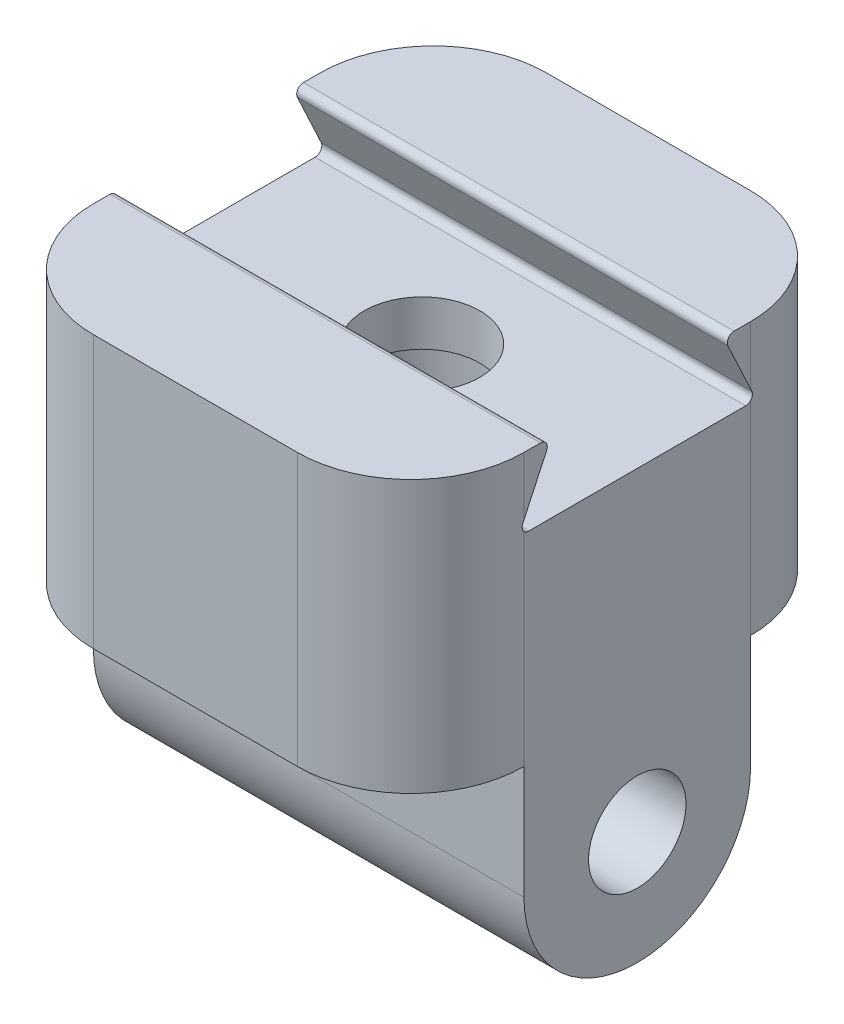
from build123d import *

# Parameters (mm, degrees)
SKETCH2_W           = 19
SKETCH2_H           = 20
BOSS_EXTRUDE1_DEPTH = 12
CUT_EXTRUDE1_DEPTH  = 25.596747752
FILLET1_R           = 5
FILLET2_R           = 0.3
SKETCH4_R           = 2.55
CUT_EXTRUDE2_DEPTH  = 2
SKETCH5_R           = 2.9
CUT_EXTRUDE3_DEPTH  = 6
SKETCH6_W           = 19
SKETCH6_H           = 10
BOSS_EXTRUDE2_DEPTH = 10
SKETCH7_R           = 2.15
CUT_EXTRUDE4_DEPTH  = 25.596747919
FILLET3_R           = 5


# Some blends are built 0.0001 mm under size
with BuildPart() as part:
    # Sketch2 → Boss-Extrude1 (new body)
    with BuildSketch(Plane(origin=(0, 0, 0), x_dir=(1, 0, 0), z_dir=(0, 1, 0))):
        Rectangle(SKETCH2_W, SKETCH2_H)
    extrude(amount=BOSS_EXTRUDE1_DEPTH)

    # Sketch3 → Cut-Extrude1 (cut, through all)
    with BuildSketch(Plane(origin=(9.5, 0, 0), x_dir=(0, 0, -1), z_dir=(1, 0, 0))):
        Polygon((-3.8, 12), (3.8, 12), (5.25, 8.890464965), (-5.25, 8.890464965), align=None)
    extrude(amount=-CUT_EXTRUDE1_DEPTH, mode=Mode.SUBTRACT)

    # Fillet1
    # the kernel refuses this fillet: 5 mm, written as the material it takes off along each edge
    with BuildSketch(Plane(origin=(-9.5, -12.5, -10), x_dir=(1, 0, 0), z_dir=(0, 1, 0)), Plane(origin=(-9.5, -12.5, 10), x_dir=(0, 0, -1), z_dir=(0, 1, 0))) as fillet1_piece_1:
        with BuildLine():
            CenterArc((FILLET1_R, -FILLET1_R), FILLET1_R, 90, 90)
            Line((0, -FILLET1_R), (0, 0))
            Line((0, 0), (FILLET1_R, 0))
        make_face()
    extrude(amount=37, mode=Mode.SUBTRACT)
    with BuildSketch(Plane(origin=(9.5, -12.5, -10), x_dir=(-1, 0, 0), z_dir=(0, 1, 0)), Plane(origin=(9.5, -12.5, 10), x_dir=(0, 0, -1), z_dir=(0, 1, 0))) as fillet1_piece_2:
        with BuildLine():
            CenterArc((FILLET1_R, FILLET1_R), FILLET1_R, 180, 90)
            Line((0, FILLET1_R), (0, 0))
            Line((0, 0), (FILLET1_R, 0))
        make_face()
    extrude(amount=37, mode=Mode.SUBTRACT)

    # Fillet2
    fillet2_edges = [part.edges().sort_by_distance(p)[0] for p in [
        (0, 12, 3.8),
        (0, 12, -3.8),
        (0, 8.890464965, -5.25),
        (0, 8.890464965, 5.25),
    ]]
    fillet(fillet2_edges, radius=FILLET2_R)

    # Sketch4 → Cut-Extrude2 (cut)
    with BuildSketch(Plane(origin=(0, 8.890464965, 0), x_dir=(1, 0, 0), z_dir=(0, 1, 0))):
        with Locations(Location((0, 0, 0), (0, 0, 270))):
            Circle(SKETCH4_R)
    extrude(amount=-CUT_EXTRUDE2_DEPTH, mode=Mode.SUBTRACT)

    # Sketch5 → Cut-Extrude3 (cut)
    with BuildSketch(Plane(origin=(0, 6.890464965, 0), x_dir=(1, 0, 0), z_dir=(0, 1, 0))):
        with Locations(Location((0, 0, 0), (0, 0, 270))):
            Circle(SKETCH5_R)
    extrude(amount=-CUT_EXTRUDE3_DEPTH, mode=Mode.SUBTRACT)

    # Sketch6 → Boss-Extrude2 (add)
    with BuildSketch(Plane.XZ):
        Rectangle(SKETCH6_W, SKETCH6_H)
    extrude(amount=BOSS_EXTRUDE2_DEPTH)

    # Sketch7 → Cut-Extrude4 (cut, through all)
    with BuildSketch(Plane(origin=(9.5, 0, 0), x_dir=(0, 0, -1), z_dir=(1, 0, 0))):
        with Locations((0, -5)):
            Circle(SKETCH7_R)
    extrude(amount=-CUT_EXTRUDE4_DEPTH, mode=Mode.SUBTRACT)

    # Fillet3
    fillet3_edges = [part.edges().sort_by_distance(p)[0] for p in [
        (0, -10, -5),
        (0, -10, 5),
    ]]
    fillet(fillet3_edges, radius=FILLET3_R - 0.0001)  # a hair under: the kernel refuses the full size


solid = part.part
